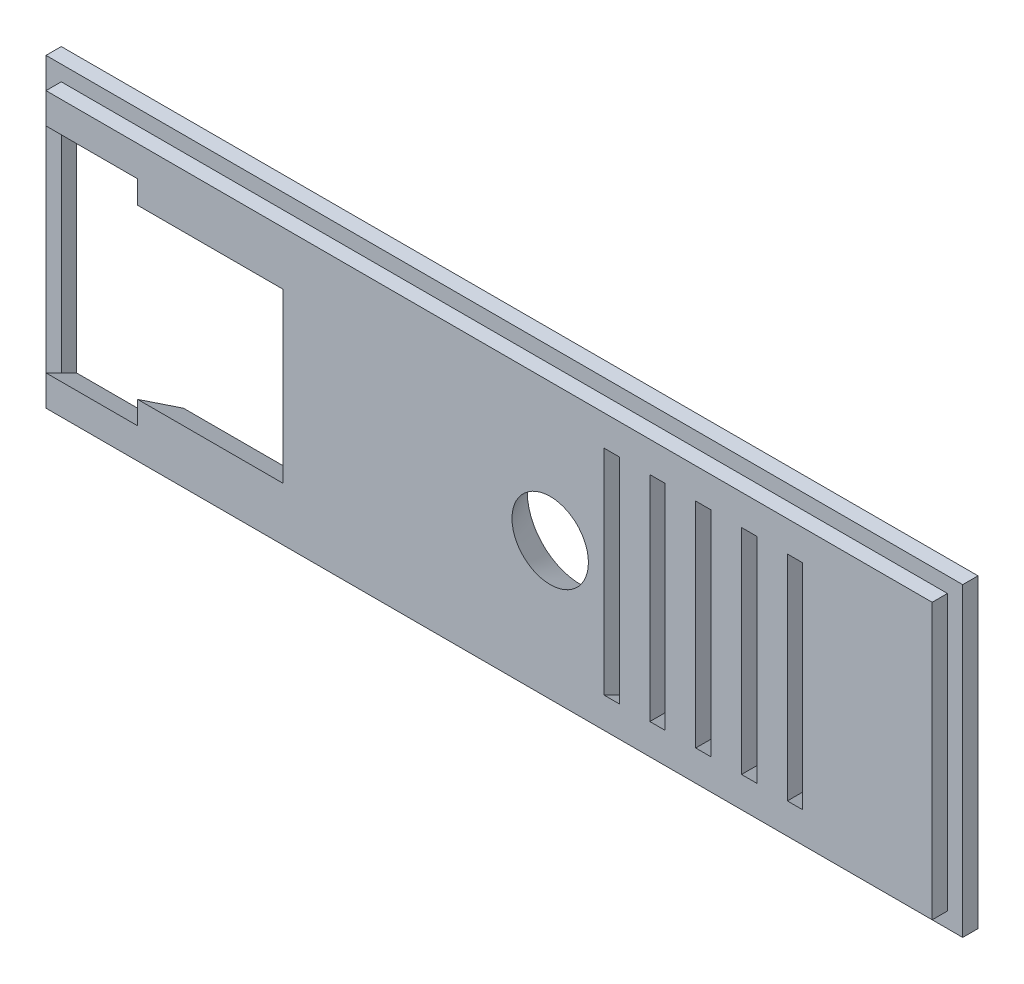
from build123d import *

# Parameters (mm, degrees)
SKETCH1_W           = 60
SKETCH1_H           = 20
BOSS_EXTRUDE1_DEPTH = 1
SKETCH2_W           = 58
SKETCH2_H           = 18
BOSS_EXTRUDE2_DEPTH = 1
SKETCH4_R           = 2.5
SKETCH4_W           = 1
SKETCH4_H           = 14
CUT_EXTRUDE2_DEPTH  = 4
CHAMFER2_START      = 7.522135998
CHAMFER2_2_DEPTH    = 13
CHAMFER2_START_2    = -23
CHAMFER2_3_DEPTH    = 10.5
CHAMFER2_START_3    = -29
CHAMFER2_4_DEPTH    = 7
CHAMFER2_START_4    = -7
CHAMFER2_5_DEPTH    = 14
CHAMFER2_START_5    = -5.5
CHAMFER2_6_DEPTH    = 11
CHAMFER2_START_6    = -9
CHAMFER2_7_DEPTH    = 18
CHAMFER2_8_DEPTH    = 2
CHAMFER2_START_7    = 7
CHAMFER2_9_DEPTH    = 2


with BuildPart() as part:
    # Sketch1 → Boss-Extrude1 (new body)
    with BuildSketch(Plane.XY):
        Rectangle(SKETCH1_W, SKETCH1_H)
    extrude(amount=BOSS_EXTRUDE1_DEPTH)

    # Sketch2 → Boss-Extrude2 (add)
    with BuildSketch(Plane.XY.offset(1)):
        Rectangle(SKETCH2_W, SKETCH2_H)
    extrude(amount=BOSS_EXTRUDE2_DEPTH)

    # Sketch4 → Cut-Extrude2 (cut)
    with BuildSketch(Plane(origin=(0, 0, 0), x_dir=(-1, 0, 0), z_dir=(0, 0, -1))):
        with Locations((-4, 0)):
            Circle(SKETCH4_R)
        Polygon((13.5, -5.5), (23, -5.5), (23, -7), (29, -7), (29, -5.5), (29, 5.5), (29, 7), (23, 7), (23, 5.5), (13.5, 5.5), align=None)
        with Locations((-20.022135998, 0)):
            Rectangle(SKETCH4_W, SKETCH4_H)
        with Locations((-17.022135998, 0)):
            Rectangle(SKETCH4_W, SKETCH4_H)
        with Locations((-14.022135998, 0)):
            Rectangle(SKETCH4_W, SKETCH4_H)
        with Locations((-11.022135998, 0)):
            Rectangle(SKETCH4_W, SKETCH4_H)
        with Locations((-8.022135998, 0)):
            Rectangle(SKETCH4_W, SKETCH4_H)
    extrude(amount=-CUT_EXTRUDE2_DEPTH, mode=Mode.SUBTRACT)

    # Chamfer2: read off the stored shape, not the designer's step
    # Chamfer2 outline → Chamfer2 (revolve, cut)
    with BuildSketch(Plane(origin=(4, 0, 0), x_dir=(1, 0, 0), z_dir=(0, -1, 0))):
        Polygon((3.5, 0), (2.5, 2), (2.5, 0), align=None)
    revolve(axis=Axis((4, 0, 0), (0, 0, 1)), mode=Mode.SUBTRACT)

    # Chamfer2 2 outline → Chamfer2 2 (cut)
    with BuildSketch(Plane.YZ.offset(CHAMFER2_START)):
        Polygon((7, 2), (7, 0), (8, 0), align=None)
        Polygon((5.5, 2), (5.5, 0), (6.5, 0), align=None)
        Polygon((-5.5, 2), (-6.5, 0), (-5.5, 0), align=None)
        Polygon((-7, 2), (-8, 0), (-7, 0), align=None)
    extrude(amount=CHAMFER2_2_DEPTH, mode=Mode.SUBTRACT)

    # Chamfer2 3 outline → Chamfer2 3 (cut)
    with BuildSketch(Plane.YZ.offset(CHAMFER2_START_2)):
        Polygon((5.5, 2), (5.5, 0), (6.5, 0), align=None)
        Polygon((-5.5, 2), (-6.5, 0), (-5.5, 0), align=None)
    extrude(amount=CHAMFER2_3_DEPTH, mode=Mode.SUBTRACT)

    # Chamfer2 4 outline → Chamfer2 4 (cut)
    with BuildSketch(Plane.YZ.offset(CHAMFER2_START_3)):
        Polygon((7, 2), (7, 0), (8, 0), align=None)
        Polygon((-7, 2), (-8, 0), (-7, 0), align=None)
    extrude(amount=CHAMFER2_4_DEPTH, mode=Mode.SUBTRACT)

    # Chamfer2 5 outline → Chamfer2 5 (cut)
    with BuildSketch(Plane(origin=(0, 0, 0), x_dir=(1, 0, 0), z_dir=(0, 1, 0)).offset(CHAMFER2_START_4)):
        Polygon((18.522135998, 0), (19.522135998, -2), (19.522135998, 0), align=None)
        Polygon((17.522135998, -2), (18.522135998, 0), (17.522135998, 0), align=None)
        Polygon((15.522135998, 0), (16.522135998, -2), (16.522135998, 0), align=None)
        Polygon((14.522135998, -2), (15.522135998, 0), (14.522135998, 0), align=None)
        Polygon((12.522135998, 0), (13.522135998, -2), (13.522135998, 0), align=None)
        Polygon((11.522135998, -2), (12.522135998, 0), (11.522135998, 0), align=None)
        Polygon((9.522135998, 0), (10.522135998, -2), (10.522135998, 0), align=None)
        Polygon((8.522135998, -2), (9.522135998, 0), (8.522135998, 0), align=None)
        Polygon((-23, -2), (-22, 0), (-23, 0), align=None)
    extrude(amount=CHAMFER2_5_DEPTH, mode=Mode.SUBTRACT)

    # Chamfer2 6 outline → Chamfer2 6 (cut)
    with BuildSketch(Plane(origin=(0, 0, 0), x_dir=(1, 0, 0), z_dir=(0, 1, 0)).offset(CHAMFER2_START_5)):
        Polygon((-13.5, -2), (-12.5, 0), (-13.5, 0), align=None)
    extrude(amount=CHAMFER2_6_DEPTH, mode=Mode.SUBTRACT)

    # Chamfer2 7 outline → Chamfer2 7 (add)
    with BuildSketch(Plane(origin=(0, 0, 0), x_dir=(1, 0, 0), z_dir=(0, 1, 0)).offset(CHAMFER2_START_6)):
        Polygon((17.522135998, -2), (19.522135998, -2), (18.522135998, 0), align=None)
        Polygon((14.522135998, -2), (16.522135998, -2), (15.522135998, 0), align=None)
        Polygon((11.522135998, -2), (13.522135998, -2), (12.522135998, 0), align=None)
        Polygon((8.522135998, -2), (10.522135998, -2), (9.522135998, 0), align=None)
        Polygon((-13.5, -2), (-12.5, -2), (-12.5, 0), align=None)
    extrude(amount=CHAMFER2_7_DEPTH)

    # Chamfer2 8 outline → Chamfer2 8 (add)
    with BuildSketch(Plane(origin=(0, 0, 0), x_dir=(1, 0, 0), z_dir=(0, 1, 0)).offset(CHAMFER2_START_6)):
        Polygon((-23, -2), (-22, -2), (-22, 0), align=None)
    extrude(amount=CHAMFER2_8_DEPTH)

    # Chamfer2 9 outline → Chamfer2 9 (add)
    with BuildSketch(Plane(origin=(0, 0, 0), x_dir=(1, 0, 0), z_dir=(0, 1, 0)).offset(CHAMFER2_START_7)):
        Polygon((-23, -2), (-22, -2), (-22, 0), align=None)
    extrude(amount=CHAMFER2_9_DEPTH)


solid = part.part
